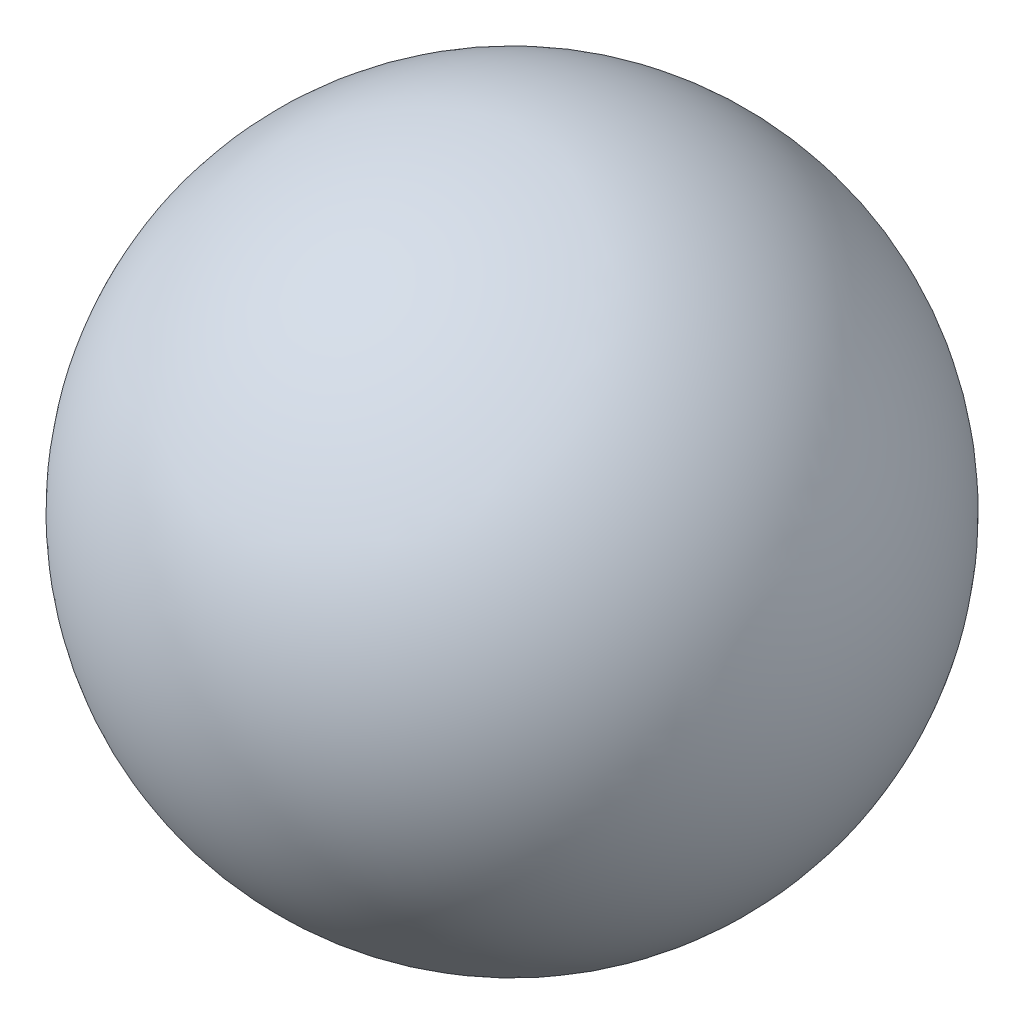
from build123d import *


with BuildPart() as part:
    # Sketch2 → Revolve1 (revolve)
    with BuildSketch(Plane.XY):
        with BuildLine():
            Line((452.266445, 0), (-452.266445, 0))
            ThreePointArc((-452.266445, 0), (0, 452.266445), (452.266445, 0))
        make_face()
    revolve(axis=Axis((452.266445, 0, 0), (-1, 0, 0)))


solid = part.part
